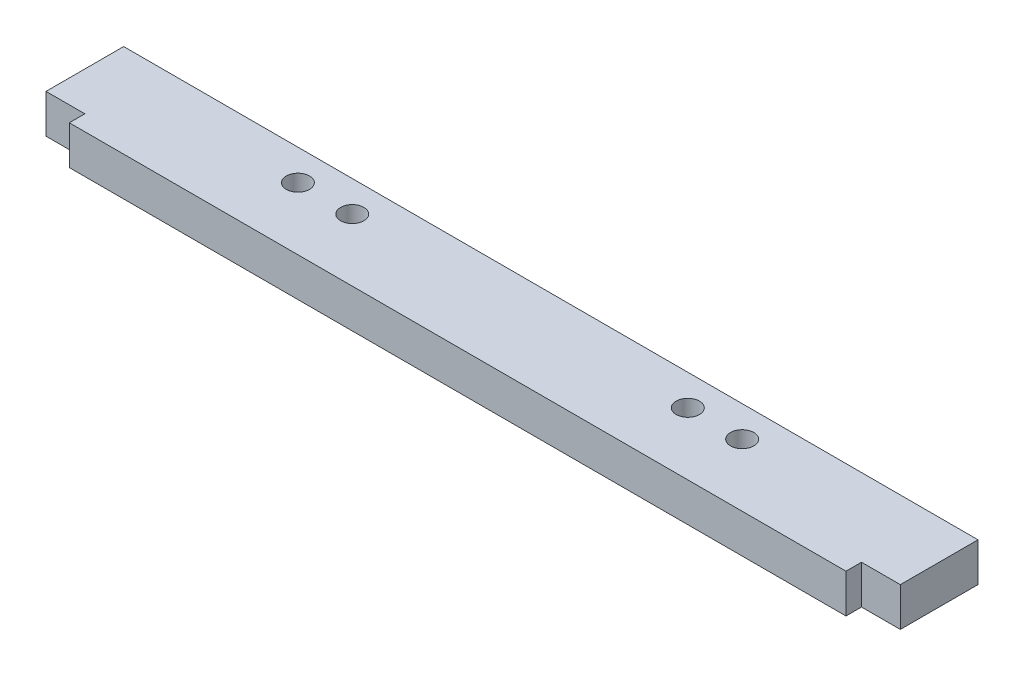
from build123d import *

# Parameters (mm, degrees)
SKETCH1_W                  = 12
SKETCH1_H                  = 5
BOSS_EXTRUDE1_DEPTH        = 110
M3_TAPPED_HOLE1_AT_2_COUNT = 2
M3_TAPPED_HOLE1_AT_2_PITCH = 7
SKETCH6_W                  = 5
SKETCH6_H                  = 2
CUT_EXTRUDE1_DEPTH         = 10


with BuildPart() as part:
    # Sketch1 → Boss-Extrude1 (new body)
    with BuildSketch(Plane(origin=(0, 0, 0), x_dir=(0, 0, -1), z_dir=(1, 0, 0))):
        with Locations((3.863110316, 3.101965352)):
            Rectangle(SKETCH1_W, SKETCH1_H)
    extrude(amount=BOSS_EXTRUDE1_DEPTH)

    # Sketch14 → M3 Tapped Hole1 (revolve, cut)
    with BuildSketch(Plane(origin=(26.397029049, 5.601965352, -5.897332737), x_dir=(0, 0, 1), z_dir=(1, 0, 0))):
        Polygon((0, 0), (0, 8.251075774), (1.25, 7.5), (1.25, 6), (1.5, 6), (1.5, 0), align=None)
    m3_tapped_hole1 = revolve(axis=Axis((26.397029049, 11.951965352, -5.897332737), (0, -1, 0)), mode=Mode.SUBTRACT)

    # M3 Tapped Hole1 at 2: M3 Tapped Hole1 ×2
    with Locations(*[(i * M3_TAPPED_HOLE1_AT_2_PITCH, 0, 0) for i in range(1, M3_TAPPED_HOLE1_AT_2_COUNT)]):
        add(m3_tapped_hole1, mode=Mode.SUBTRACT)

    # Mirror3: M3 Tapped Hole1 across plane
    add(m3_tapped_hole1.mirror(Plane(origin=(55, 0, 0), x_dir=(0, 0, 1), z_dir=(1, 0, 0))), mode=Mode.SUBTRACT)

    # Mirror3 copy 1 sketch → Mirror3 copy 1 (revolve, cut)
    with BuildSketch(Plane(origin=(76.602970951, 5.601965352, -5.897332737), x_dir=(0, 0, 1), z_dir=(-1, 0, 0))):
        Polygon((0, 0), (0, -8.251075774), (1.25, -7.5), (1.25, -6), (1.5, -6), (1.5, 0), align=None)
    revolve(axis=Axis((76.602970951, 11.951965352, -5.897332737), (0, 1, 0)), mode=Mode.SUBTRACT)

    # Sketch6 → Cut-Extrude1 (cut)
    with BuildSketch(Plane(origin=(0, 5.601965352, 0), x_dir=(1, 0, 0), z_dir=(0, 1, 0))):
        with Locations((2.5, -1.136889684)):
            Rectangle(SKETCH6_W, SKETCH6_H)
    cut_extrude1 = extrude(amount=-CUT_EXTRUDE1_DEPTH, mode=Mode.SUBTRACT)

    # Mirror4: Cut-Extrude1 across plane
    add(cut_extrude1.mirror(Plane(origin=(55, 0, 0), x_dir=(0, 0, 1), z_dir=(1, 0, 0))), mode=Mode.SUBTRACT)


solid = part.part
